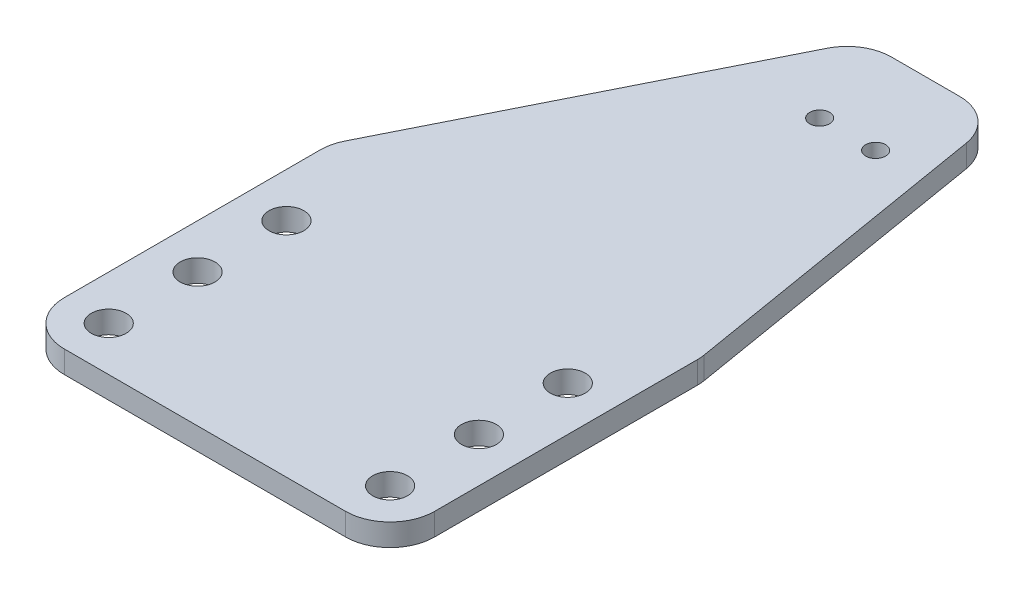
from build123d import *

# Parameters (mm, degrees)
SKETCH1_R           = 2.4892
SKETCH1_R_2         = 1.4224
BOSS_EXTRUDE1_DEPTH = 3.175
FILLET1_R           = 6.35


with BuildPart() as part:
    # Sketch1 → Boss-Extrude1 (new body)
    with BuildSketch(Plane(origin=(0, 0, 0), x_dir=(1, 0, 0), z_dir=(0, 1, 0))):
        Polygon((0, 0), (52.916666667, 0), (52.916666667, 44.45), (44.45, 95.25), (25.4, 95.25), (0, 44.45), align=None)
        with Locations((6.35, 6.35)):
            Circle(SKETCH1_R, mode=Mode.SUBTRACT)
        with Locations((6.35, 19.05)):
            Circle(SKETCH1_R, mode=Mode.SUBTRACT)
        with Locations((6.35, 31.75)):
            Circle(SKETCH1_R, mode=Mode.SUBTRACT)
        with Locations((46.566666667, 6.35)):
            Circle(SKETCH1_R, mode=Mode.SUBTRACT)
        with Locations((46.566666667, 19.05)):
            Circle(SKETCH1_R, mode=Mode.SUBTRACT)
        with Locations((46.566666667, 31.75)):
            Circle(SKETCH1_R, mode=Mode.SUBTRACT)
        with Locations((31.75508, 82.56016)):
            Circle(SKETCH1_R_2, mode=Mode.SUBTRACT)
        with Locations((39.755080002, 82.56016)):
            Circle(SKETCH1_R_2, mode=Mode.SUBTRACT)
    extrude(amount=BOSS_EXTRUDE1_DEPTH)

    # Fillet1
    fillet1_edges = [part.edges().sort_by_distance(p)[0] for p in [
        (52.916666667, 1.5875, 0),
        (0, 1.5875, -44.45),
        (44.45, 1.5875, -95.25),
        (52.916666667, 1.5875, -44.45),
        (0, 1.5875, 0),
        (25.4, 1.5875, -95.25),
    ]]
    fillet(fillet1_edges, radius=FILLET1_R)


solid = part.part
